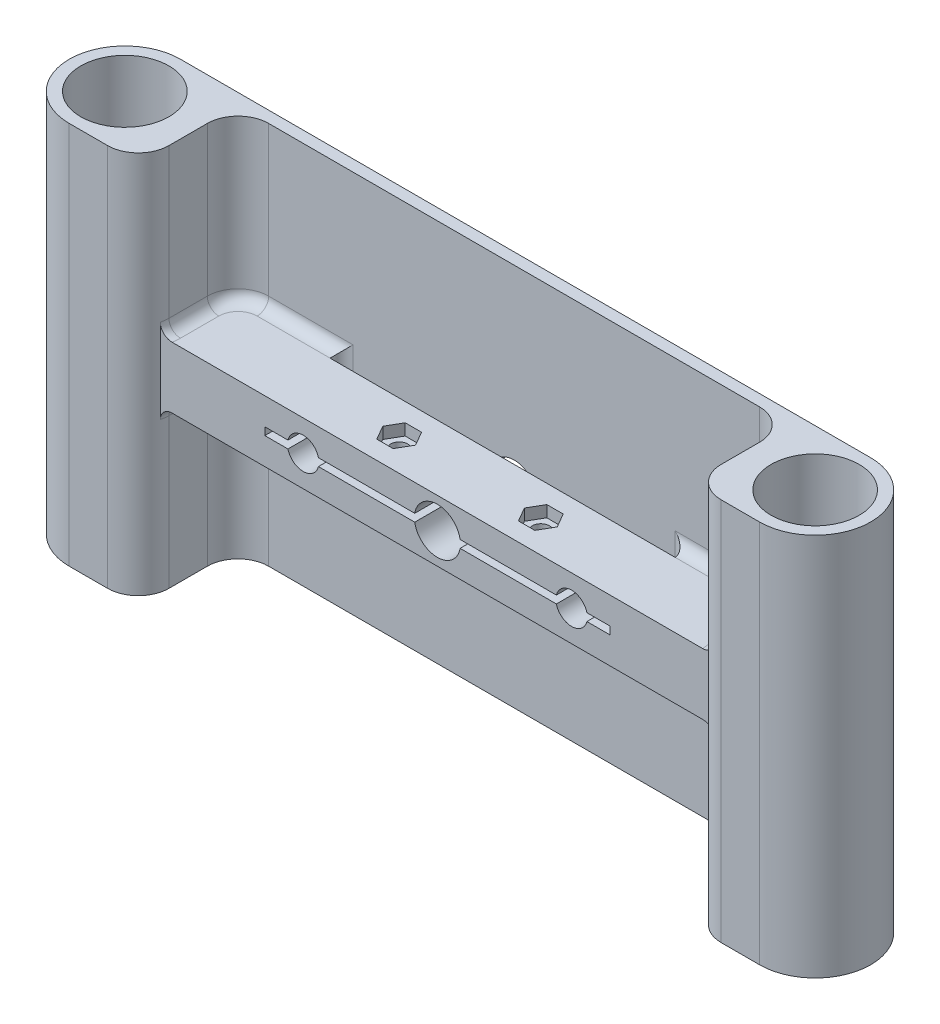
from build123d import *

# Parameters (mm, degrees)
SKETCH1_R                    = 11.5
BOSS_EXTRUDE1_DEPTH          = 100
FILLET1_R                    = 8
SKETCH2_R                    = 4.1
SKETCH2_R_2                  = 6
CUT_EXTRUDE1_DEPTH           = 10
BOSS_EXTRUDE2_START          = 20
SKETCH3_R                    = 4.1
SKETCH3_R_2                  = 6
BOSS_EXTRUDE2_DEPTH          = 20
FILLET2_R                    = 3
CUT_EXTRUDE_THIN1_DEPTH      = 184.360351078
CUT_EXTRUDE_THIN1_DEPTH_BACK = 20
CUT_EXTRUDE_THIN2_DEPTH      = 164.298096582
CUT_EXTRUDE_THIN2_DEPTH_BACK = 20
FILLET3_R                    = 3
CUT_EXTRUDE2_DEPTH           = 161.944923335
CUT_EXTRUDE2_DEPTH_BACK      = 161.944923335
SKETCH6_R                    = 2.25
CUT_EXTRUDE3_DEPTH           = 3


with BuildPart() as part:
    # Sketch1 → Boss-Extrude1 (new body)
    with BuildSketch(Plane(origin=(0, 0, 0), x_dir=(1, 0, 0), z_dir=(0, 1, 0))):
        with BuildLine():
            Line((137.460581558, -14.5), (119.460581558, -14.5))
            Line((119.460581558, -14.5), (119.460581558, 11.5))
            Line((119.460581558, 11.5), (-24.539418442, 11.5))
            Line((-24.539418442, 11.5), (-24.539418442, -14.5))
            Line((-24.539418442, -14.5), (-42.539418442, -14.5))
            ThreePointArc((-42.539418442, -14.5), (-57.039418442, 0), (-42.539418442, 14.5))
            Line((-42.539418442, 14.5), (137.460581558, 14.5))
            ThreePointArc((137.460581558, 14.5), (151.960581558, 0), (137.460581558, -14.5))
        make_face()
        with Locations(Location((-42.539418442, 0, 0), (0, 0, 270))):
            Circle(SKETCH1_R, mode=Mode.SUBTRACT)
        with Locations(Location((137.460581558, 0, 0), (0, 0, 270))):
            Circle(SKETCH1_R, mode=Mode.SUBTRACT)
    extrude(amount=BOSS_EXTRUDE1_DEPTH)

    # Fillet1
    fillet1_edges = [part.edges().sort_by_distance(p)[0] for p in [
        (119.460581558, 50, 14.5),
        (119.460581558, 50, -11.5),
        (-24.539418442, 50, -11.5),
        (-24.539418442, 50, 14.5),
    ]]
    fillet(fillet1_edges, radius=FILLET1_R)

    # Sketch2 → Cut-Extrude1 (cut)
    with BuildSketch(Plane.XY.offset(-11.5)):
        with Locations((12.460581558, 50)):
            Circle(SKETCH2_R)
        with Locations((82.460581558, 50)):
            Circle(SKETCH2_R)
        with Locations((47.460581558, 50)):
            Circle(SKETCH2_R_2)
    extrude(amount=-CUT_EXTRUDE1_DEPTH, mode=Mode.SUBTRACT)

    # Sketch3 → Boss-Extrude2 (add)
    with BuildSketch(Plane.XY.offset(-11.5).offset(BOSS_EXTRUDE2_START)):
        Polygon((12.460581558, 58), (82.460581558, 58), (124.149440998, 58), (124.149440998, 42), (82.460581558, 42), (12.460581558, 42), (-28.8662965, 42), (-28.8662965, 58), (-16.539418442, 58), align=None)
        with Locations((12.460581558, 50)):
            Circle(SKETCH3_R, mode=Mode.SUBTRACT)
        with Locations((82.460581558, 50)):
            Circle(SKETCH3_R, mode=Mode.SUBTRACT)
        with Locations((47.460581558, 50)):
            Circle(SKETCH3_R_2, mode=Mode.SUBTRACT)
    extrude(amount=-BOSS_EXTRUDE2_DEPTH)

    # Fillet2
    fillet2_edges = [part.edges().sort_by_distance(p)[0] for p in [
        (-24.603180872, 58, 7.50803434),
        (-24.603180872, 42, 7.50803434),
        (47.460581558, 42, -11.5),
        (117.117435807, 42, -9.156854249),
        (119.460581558, 42, 1.5),
        (-24.539418442, 42, 1.5),
        (-22.196272692, 42, -9.156854249),
        (119.524343988, 42, 7.50803434),
        (119.460581558, 58, 1.5),
        (117.117435807, 58, -9.156854249),
        (47.460581558, 58, -11.5),
        (-22.196272692, 58, -9.156854249),
        (-24.539418442, 58, 1.5),
        (119.524343988, 58, 7.50803434),
    ]]
    fillet(fillet2_edges, radius=FILLET2_R)

    # Sketch4 → Cut-Extrude-Thin1 (cut, two sides: drawn at the far end of the back side and taken through both)
    with BuildSketch(Plane.XY.offset(8.5).offset(-CUT_EXTRUDE_THIN1_DEPTH_BACK)):
        Polygon((92.460581558, 51), (47.460581558, 51), (2.460581558, 51), (2.460581558, 49), (47.460581558, 49), (92.460581558, 49), align=None)
    extrude(amount=CUT_EXTRUDE_THIN1_DEPTH + CUT_EXTRUDE_THIN1_DEPTH_BACK, mode=Mode.SUBTRACT)

    # Sketch5 → Cut-Extrude-Thin2 (cut, two sides: drawn at the far end of the back side and taken through both)
    with BuildSketch(Plane(origin=(0, 42, 0), x_dir=(-1, 0, 0), z_dir=(0, -1, 0)).offset(-CUT_EXTRUDE_THIN2_DEPTH_BACK)):
        Polygon((-2.460581558, 8.5), (-47.460581558, 8.5), (-92.460581558, 8.5), (-92.460581558, 11.5), (-47.460581558, 11.5), (-2.460581558, 11.5), align=None)
    extrude(amount=CUT_EXTRUDE_THIN2_DEPTH + CUT_EXTRUDE_THIN2_DEPTH_BACK, mode=Mode.SUBTRACT)

    # Fillet3
    fillet3_edges = [part.edges().sort_by_distance(p)[0] for p in [
        (2.460581558, 50, -11.5),
        (92.460581558, 50, -11.5),
    ]]
    fillet(fillet3_edges, radius=FILLET3_R - 0.0001)  # a hair under: the kernel refuses the full size

    # Sketch6 → Cut-Extrude2 (cut, two sides: drawn at the far end of the back side and taken through both)
    with BuildSketch(Plane(origin=(0, 49, 0), x_dir=(1, 0, 0), z_dir=(0, 1, 0)).offset(-CUT_EXTRUDE2_DEPTH_BACK)):
        with Locations(Location((28.990631201, 0, 0), (0, 0, 270))):
            Circle(SKETCH6_R)
        with Locations(Location((65.930531914, 0, 0), (0, 0, 270))):
            Circle(SKETCH6_R)
    extrude(amount=CUT_EXTRUDE2_DEPTH + CUT_EXTRUDE2_DEPTH_BACK, mode=Mode.SUBTRACT)

    # Sketch7 → Cut-Extrude3 (cut)
    with BuildSketch(Plane(origin=(0, 58, 0), x_dir=(1, 0, 0), z_dir=(0, 1, 0))):
        Polygon((33.263023193, 0), (31.126827197, 3.7), (26.854435205, 3.7), (24.718239209, 0), (26.854435205, -3.7), (31.126827197, -3.7), align=None)
        Polygon((70.202923906, 0), (68.06672791, 3.7), (63.794335918, 3.7), (61.658139922, 0), (63.794335918, -3.7), (68.06672791, -3.7), align=None)
    extrude(amount=-CUT_EXTRUDE3_DEPTH, mode=Mode.SUBTRACT)


solid = part.part
